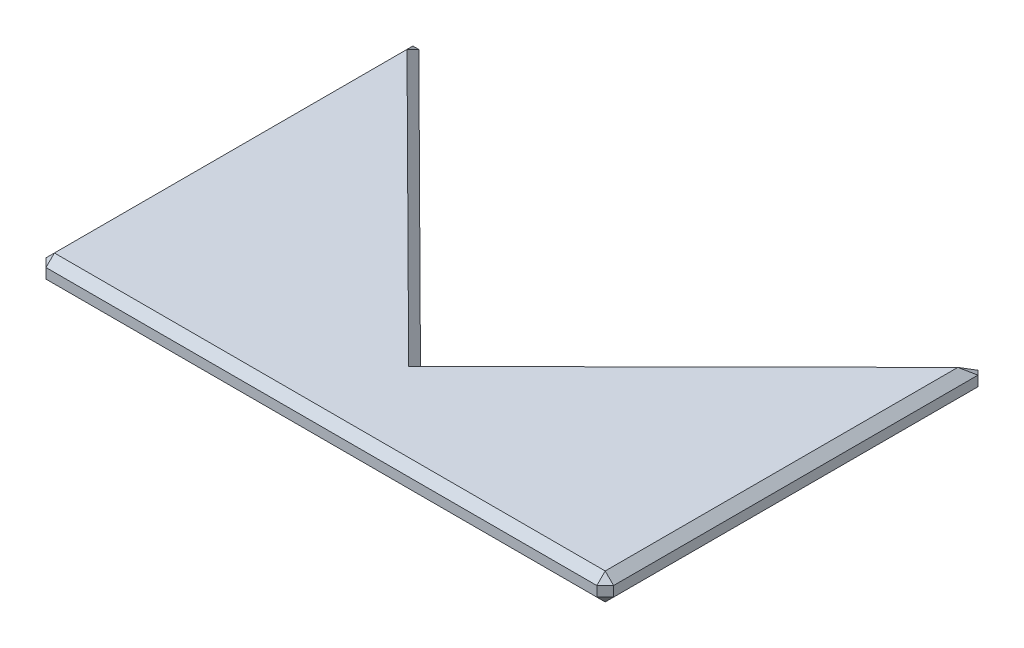
from build123d import *

# Parameters (mm, degrees)
BOSS_EXTRUDE1_DEPTH = 1.6


with BuildPart() as part:
    # Sketch1 → Boss-Extrude1 (new body)
    with BuildSketch(Plane(origin=(0, 0, 0), x_dir=(1, 0, 0), z_dir=(0, 1, 0))):
        Polygon((16.9, 22.7), (16.9, 0), (-16.9, 0), (-16.9, 22.7), (0, 5.9), align=None)
    extrude(amount=BOSS_EXTRUDE1_DEPTH)

    # Chamfer1
    # the kernel refuses this chamfer: 0.5, 0.353554947 mm, written as the material it takes off along each edge
    with BuildSketch(Plane(origin=(-16.566666667, 1.266666667, -0.333333333), x_dir=(-0.7071067811865475, 0, -0.7071067811865475), z_dir=(-0.5773502691896256, 0.5773502691896261, 0.5773502691896256)), Plane(origin=(16.566666667, 1.266666667, -0.333333333), x_dir=(-0.7071067811865475, 0, 0.7071067811865475), z_dir=(0.5773502691896258, 0.5773502691896256, 0.5773502691896258))) as chamfer1_piece_1:
        Polygon((-0.353553391, 0.204124145), (0.353553391, 0.204124145), (0, -0.40824829), align=None)
    extrude(amount=0.635085296, mode=Mode.SUBTRACT)
    with BuildSketch(Plane(origin=(-16.615133017, 1.266666667, -22.06396102), x_dir=(0.9999955974192072, 0, -0.0029673459864134454), z_dir=(-0.0015045248311199464, 0.8619301129134874, -0.507024868086345))) as chamfer1_piece_2:
        Polygon((-0.284027501, 0.328713527), (0.070575009, 0.328713527), (0.213452492, -0.657427055), align=None)
    extrude(amount=0.671248828, mode=Mode.SUBTRACT)
    with BuildSketch(Plane(origin=(16.64975272, 1.266666667, -22.049560855), x_dir=(-0.7071067811865375, 0, -0.7071067811865576), z_dir=(0.35852230087747156, 0.8619301129134861, -0.3585223008774614))) as chamfer1_piece_3:
        Polygon((-0.070575009, -0.328713527), (0.284027501, -0.328713527), (-0.213452492, 0.657427055), align=None)
    extrude(amount=0.671248828, mode=Mode.SUBTRACT)
    with BuildSketch(Plane(origin=(16.64975272, 0.333333333, -22.049560855), x_dir=(-0.7071067811865375, 0, -0.7071067811865576), z_dir=(0.3585223008774716, -0.8619301129134861, -0.3585223008774613))) as chamfer1_piece_4:
        Polygon((-0.070575009, 0.328713527), (0.284027501, 0.328713527), (-0.213452492, -0.657427055), align=None)
    extrude(amount=0.671248828, mode=Mode.SUBTRACT)
    with BuildSketch(Plane(origin=(16.566666667, 0.333333333, -0.333333333), x_dir=(-0.7071067811865475, 0, 0.7071067811865475), z_dir=(0.5773502691896258, -0.5773502691896257, 0.5773502691896258)), Plane(origin=(-16.566666667, 0.333333333, -0.333333333), x_dir=(-0.7071067811865475, 0, -0.7071067811865475), z_dir=(-0.5773502691896256, -0.5773502691896261, 0.5773502691896255))) as chamfer1_piece_5:
        Polygon((-0.353553391, -0.204124145), (0.353553391, -0.204124145), (0, 0.40824829), align=None)
    extrude(amount=0.635085296, mode=Mode.SUBTRACT)
    with BuildSketch(Plane(origin=(-16.615133017, 0.333333333, -22.06396102), x_dir=(0.9999955974192072, 0, -0.0029673459864134454), z_dir=(-0.0015045248311200809, -0.8619301129134874, -0.507024868086345))) as chamfer1_piece_6:
        Polygon((-0.284027501, -0.328713527), (0.070575009, -0.328713527), (0.213452492, 0.657427055), align=None)
    extrude(amount=0.671248828, mode=Mode.SUBTRACT)
    with BuildSketch(Plane(origin=(-16.9, 1.6, 1.285841494), x_dir=(-0.02749587661058907, -0.9996219169112965, 0), z_dir=(0, 0, -1)), Plane(origin=(16.9, 1.6, -23.985841494), x_dir=(0.02749587661058907, -0.9996219169112965, 0), z_dir=(0, 0, 1))) as chamfer1_piece_7:
        with BuildLine():
            Line((0.514336598, 0), (-0.028273577, -0.513558897))
            Line((-0.028273577, -0.513558897), (-0.038269797, -0.513283938))
            ThreePointArc((-0.038269797, -0.513283938), (-0.017064614, -0.256698915), (-0.009996219, 0.000274959))
            Line((-0.009996219, 0.000274959), (0.000274959, 0.009996219))
            ThreePointArc((0.000274959, 0.009996219), (0.257248832, 0.002927825), (0.514611556, 0.009996219))
            Line((0.514611556, 0.009996219), (0.514336598, 0))
        make_face()
    extrude(amount=25.271682988, mode=Mode.SUBTRACT)
    with BuildSketch(Plane(origin=(18.185841494, 1.6, 0), x_dir=(0, -0.9996219169112968, 0.02749587661058636), z_dir=(-1, 0, 0))) as chamfer1_piece_8:
        with BuildLine():
            Line((0.514336598, 0), (-0.028273577, -0.513558897))
            Line((-0.028273577, -0.513558897), (-0.038269797, -0.513283938))
            ThreePointArc((-0.038269797, -0.513283938), (-0.017064614, -0.256698915), (-0.009996219, 0.000274959))
            Line((-0.009996219, 0.000274959), (0.000274959, 0.009996219))
            ThreePointArc((0.000274959, 0.009996219), (0.257248832, 0.002927825), (0.514611556, 0.009996219))
            Line((0.514611556, 0.009996219), (0.514336598, 0))
        make_face()
    extrude(amount=36.371682988, mode=Mode.SUBTRACT)
    with BuildSketch(Plane(origin=(-0.911921229, 1.6, -4.993474755), x_dir=(-0.019384742522666594, -0.9996219169112968, -0.01950012789482532), z_dir=(0.7092018985609293, 0, -0.7050054376226992))) as chamfer1_piece_9_section:
        with BuildLine():
            Line((0.514336598, 0), (-0.028273577, -0.513558897))
            Line((-0.028273577, -0.513558897), (-0.038269797, -0.513283938))
            ThreePointArc((-0.038269797, -0.513283938), (-0.017064614, -0.256698915), (-0.009996219, 0.000274959))
            Line((-0.009996219, 0.000274959), (0.000274959, 0.009996219))
            ThreePointArc((0.000274959, 0.009996219), (0.257248832, 0.002927825), (0.514611556, 0.009996219))
            Line((0.514611556, 0.009996219), (0.514336598, 0))
        make_face()
    chamfer1_piece_9 = extrude(amount=26.401286426, mode=Mode.PRIVATE)
    chamfer1_piece_9 = split(chamfer1_piece_9, bisect_by=Plane(origin=(0.169796373, 1.435101181, -5.731208339), z_dir=(0.705005437622699, 0, -0.7092018985609295)), keep=Keep.TOP, mode=Mode.PRIVATE)
    add(chamfer1_piece_9, mode=Mode.SUBTRACT)
    with BuildSketch(Plane(origin=(16.9, 0, -23.985841494), x_dir=(0.02749587661058908, 0.9996219169112968, 0), z_dir=(0, 0, 1)), Plane(origin=(-16.9, 0, 1.285841494), x_dir=(-0.02749587661058908, 0.9996219169112968, 0), z_dir=(0, 0, -1))) as chamfer1_piece_10:
        with BuildLine():
            Line((0.514336598, 0), (-0.028273577, 0.513558897))
            Line((-0.028273577, 0.513558897), (-0.038269797, 0.513283938))
            ThreePointArc((-0.038269797, 0.513283938), (-0.017064614, 0.256698915), (-0.009996219, -0.000274959))
            Line((-0.009996219, -0.000274959), (0.000274959, -0.009996219))
            ThreePointArc((0.000274959, -0.009996219), (0.257248832, -0.002927825), (0.514611556, -0.009996219))
            Line((0.514611556, -0.009996219), (0.514336598, 0))
        make_face()
    extrude(amount=25.271682988, mode=Mode.SUBTRACT)
    with BuildSketch(Plane(origin=(18.185841494, 0, 0), x_dir=(0, 0.9996219169112968, 0.02749587661058637), z_dir=(-1, 0, 0))) as chamfer1_piece_11:
        with BuildLine():
            Line((0.514336598, 0), (-0.028273577, 0.513558897))
            Line((-0.028273577, 0.513558897), (-0.038269797, 0.513283938))
            ThreePointArc((-0.038269797, 0.513283938), (-0.017064614, 0.256698915), (-0.009996219, -0.000274959))
            Line((-0.009996219, -0.000274959), (0.000274959, -0.009996219))
            ThreePointArc((0.000274959, -0.009996219), (0.257248832, -0.002927825), (0.514611556, -0.009996219))
            Line((0.514611556, -0.009996219), (0.514336598, 0))
        make_face()
    extrude(amount=36.371682988, mode=Mode.SUBTRACT)
    with BuildSketch(Plane(origin=(-17.811921229, 0, -23.606525245), x_dir=(0.019384742522664138, 0.9996219169112968, -0.019500127894822857), z_dir=(0.7092018985609295, 0, 0.705005437622699))) as chamfer1_piece_12_section:
        with BuildLine():
            Line((0.514336598, 0), (-0.028273577, 0.513558897))
            Line((-0.028273577, 0.513558897), (-0.038269797, 0.513283938))
            ThreePointArc((-0.038269797, 0.513283938), (-0.017064614, 0.256698915), (-0.009996219, -0.000274959))
            Line((-0.009996219, -0.000274959), (0.000274959, -0.009996219))
            ThreePointArc((0.000274959, -0.009996219), (0.257248832, -0.002927825), (0.514611556, -0.009996219))
            Line((0.514611556, -0.009996219), (0.514336598, 0))
        make_face()
    chamfer1_piece_12 = extrude(amount=26.401286426, mode=Mode.PRIVATE)
    chamfer1_piece_12 = split(chamfer1_piece_12, bisect_by=Plane(origin=(-0.169796373, 0.164898819, -5.731208339), z_dir=(-0.7050054376226992, 0, -0.7092018985609293)), keep=Keep.TOP, mode=Mode.PRIVATE)
    add(chamfer1_piece_12, mode=Mode.SUBTRACT)
    with BuildSketch(Plane(origin=(-0.911921229, 0, -4.993474755), x_dir=(-0.0193847425226666, 0.9996219169112968, -0.019500127894825324), z_dir=(0.7092018985609293, 0, -0.7050054376226992))) as chamfer1_piece_13_section:
        with BuildLine():
            Line((0.514336598, 0), (-0.028273577, 0.513558897))
            Line((-0.028273577, 0.513558897), (-0.038269797, 0.513283938))
            ThreePointArc((-0.038269797, 0.513283938), (-0.017064614, 0.256698915), (-0.009996219, -0.000274959))
            Line((-0.009996219, -0.000274959), (0.000274959, -0.009996219))
            ThreePointArc((0.000274959, -0.009996219), (0.257248832, -0.002927825), (0.514611556, -0.009996219))
            Line((0.514611556, -0.009996219), (0.514336598, 0))
        make_face()
    chamfer1_piece_13 = extrude(amount=26.401286426, mode=Mode.PRIVATE)
    chamfer1_piece_13 = split(chamfer1_piece_13, bisect_by=Plane(origin=(0.169796373, 0.164898819, -5.731208339), z_dir=(0.705005437622699, 0, -0.7092018985609295)), keep=Keep.TOP, mode=Mode.PRIVATE)
    add(chamfer1_piece_13, mode=Mode.SUBTRACT)
    with BuildSketch(Plane(origin=(-17.811921229, 1.6, -23.606525245), x_dir=(0.019384742522664134, -0.9996219169112968, -0.019500127894822854), z_dir=(0.7092018985609295, 0, 0.705005437622699))) as chamfer1_piece_14_section:
        with BuildLine():
            Line((0.514336598, 0), (-0.028273577, -0.513558897))
            Line((-0.028273577, -0.513558897), (-0.038269797, -0.513283938))
            ThreePointArc((-0.038269797, -0.513283938), (-0.017064614, -0.256698915), (-0.009996219, 0.000274959))
            Line((-0.009996219, 0.000274959), (0.000274959, 0.009996219))
            ThreePointArc((0.000274959, 0.009996219), (0.257248832, 0.002927825), (0.514611556, 0.009996219))
            Line((0.514611556, 0.009996219), (0.514336598, 0))
        make_face()
    chamfer1_piece_14 = extrude(amount=26.401286426, mode=Mode.PRIVATE)
    chamfer1_piece_14 = split(chamfer1_piece_14, bisect_by=Plane(origin=(-0.169796373, 1.435101181, -5.731208339), z_dir=(-0.7050054376226992, 0, -0.7092018985609293)), keep=Keep.TOP, mode=Mode.PRIVATE)
    add(chamfer1_piece_14, mode=Mode.SUBTRACT)
    with BuildSketch(Plane(origin=(16.9, -1.285841494, 0), x_dir=(0.02749587661058908, 0, -0.9996219169112968), z_dir=(0, 1, 0)), Plane(origin=(-16.9, -1.285841494, 0), x_dir=(0.9996219169112968, 0, 0.027495876610586178), z_dir=(0, 1, 0))) as chamfer1_piece_15:
        with BuildLine():
            Line((0.514336598, 0), (-0.028273577, 0.513558897))
            Line((-0.028273577, 0.513558897), (-0.038269797, 0.513283938))
            ThreePointArc((-0.038269797, 0.513283938), (-0.017064614, 0.256698915), (-0.009996219, -0.000274959))
            Line((-0.009996219, -0.000274959), (0.000274959, -0.009996219))
            ThreePointArc((0.000274959, -0.009996219), (0.257248832, -0.002927825), (0.514611556, -0.009996219))
            Line((0.514611556, -0.009996219), (0.514336598, 0))
        make_face()
    extrude(amount=4.171682988, mode=Mode.SUBTRACT)
    with BuildSketch(Plane(origin=(16.9, -1.285841494, -22.7), x_dir=(0.027495876610589005, 0, 0.9996219169112968), z_dir=(0, 1, 0))) as chamfer1_piece_16:
        with BuildLine():
            Line((0.514336598, 0), (0.227743914, -0.271248548))
            Line((0.227743914, -0.271248548), (0.220460729, -0.278100936))
            ThreePointArc((0.220460729, -0.278100936), (0.113871925, -0.135624304), (-0.007283185, -0.006852388))
            Line((-0.007283185, -0.006852388), (0.000274959, 0.009996219))
            ThreePointArc((0.000274959, 0.009996219), (0.257248832, 0.002927825), (0.514611556, 0.009996219))
            Line((0.514611556, 0.009996219), (0.514336598, 0))
        make_face()
    extrude(amount=4.171682988, mode=Mode.SUBTRACT)
    with BuildSketch(Plane(origin=(-16.9, -1.285841494, -22.7), x_dir=(-0.05646830535179678, 0, 0.9984043922633233), z_dir=(0, 1, 0))) as chamfer1_piece_17:
        with BuildLine():
            Line((0.354179425, 0), (0.330727935, 0.393905025))
            Line((0.330727935, 0.393905025), (0.323249127, 0.400543356))
            ThreePointArc((0.323249127, 0.400543356), (0.163173475, 0.198896835), (-0.007478808, 0.006638331))
            Line((-0.007478808, 0.006638331), (0.000564683, -0.009984044))
            ThreePointArc((0.000564683, -0.009984044), (0.177089715, -4.4e-08), (0.354744109, -0.009984044))
            Line((0.354744109, -0.009984044), (0.354179425, 0))
        make_face()
    extrude(amount=4.171682988, mode=Mode.SUBTRACT)
    with BuildSketch(Plane(origin=(-17.811921229, 1.6, -23.606525245), x_dir=(0.019384742522664134, -0.9996219169112968, -0.019500127894822854), z_dir=(0.7092018985609295, 0, 0.705005437622699))) as chamfer1_piece_18a_section:
        with BuildLine():
            Line((0.514336598, 0), (-0.028273577, -0.513558897))
            Line((-0.028273577, -0.513558897), (-0.038269797, -0.513283938))
            ThreePointArc((-0.038269797, -0.513283938), (-0.017064614, -0.256698915), (-0.009996219, 0.000274959))
            Line((-0.009996219, 0.000274959), (0.000274959, 0.009996219))
            ThreePointArc((0.000274959, 0.009996219), (0.257248832, 0.002927825), (0.514611556, 0.009996219))
            Line((0.514611556, 0.009996219), (0.514336598, 0))
        make_face()
    chamfer1_piece_18a = extrude(amount=26.401286426, mode=Mode.PRIVATE)
    chamfer1_piece_18a = split(chamfer1_piece_18a, bisect_by=Plane(origin=(-0.114291086, 1.435142329, -5.786385193), z_dir=(0.7050054376226992, 0, 0.7092018985609293)), keep=Keep.TOP, mode=Mode.PRIVATE)
    with BuildSketch(Plane(origin=(-0.911921229, 1.6, -4.993474755), x_dir=(-0.019384742522666594, -0.9996219169112968, -0.01950012789482532), z_dir=(0.7092018985609293, 0, -0.7050054376226992))) as chamfer1_piece_18b_section:
        with BuildLine():
            Line((0.514336598, 0), (-0.028273577, -0.513558897))
            Line((-0.028273577, -0.513558897), (-0.038269797, -0.513283938))
            ThreePointArc((-0.038269797, -0.513283938), (-0.017064614, -0.256698915), (-0.009996219, 0.000274959))
            Line((-0.009996219, 0.000274959), (0.000274959, 0.009996219))
            ThreePointArc((0.000274959, 0.009996219), (0.257248832, 0.002927825), (0.514611556, 0.009996219))
            Line((0.514611556, 0.009996219), (0.514336598, 0))
        make_face()
    chamfer1_piece_18b = extrude(amount=26.401286426, mode=Mode.PRIVATE)
    chamfer1_piece_18b = split(chamfer1_piece_18b, bisect_by=Plane(origin=(0.114291086, 1.435142329, -5.786385193), z_dir=(-0.705005437622699, 0, 0.7092018985609295)), keep=Keep.TOP, mode=Mode.PRIVATE)
    chamfer1_piece_18 = chamfer1_piece_18a & chamfer1_piece_18b
    add(chamfer1_piece_18, mode=Mode.SUBTRACT)
    with BuildSketch(Plane(origin=(-17.811921229, 0, -23.606525245), x_dir=(0.019384742522664138, 0.9996219169112968, -0.019500127894822857), z_dir=(0.7092018985609295, 0, 0.705005437622699))) as chamfer1_piece_19a_section:
        with BuildLine():
            Line((0.514336598, 0), (-0.028273577, 0.513558897))
            Line((-0.028273577, 0.513558897), (-0.038269797, 0.513283938))
            ThreePointArc((-0.038269797, 0.513283938), (-0.017064614, 0.256698915), (-0.009996219, -0.000274959))
            Line((-0.009996219, -0.000274959), (0.000274959, -0.009996219))
            ThreePointArc((0.000274959, -0.009996219), (0.257248832, -0.002927825), (0.514611556, -0.009996219))
            Line((0.514611556, -0.009996219), (0.514336598, 0))
        make_face()
    chamfer1_piece_19a = extrude(amount=26.401286426, mode=Mode.PRIVATE)
    chamfer1_piece_19a = split(chamfer1_piece_19a, bisect_by=Plane(origin=(-0.114291086, 0.164857671, -5.786385193), z_dir=(0.7050054376226992, 0, 0.7092018985609293)), keep=Keep.TOP, mode=Mode.PRIVATE)
    with BuildSketch(Plane(origin=(-0.911921229, 0, -4.993474755), x_dir=(-0.0193847425226666, 0.9996219169112968, -0.019500127894825324), z_dir=(0.7092018985609293, 0, -0.7050054376226992))) as chamfer1_piece_19b_section:
        with BuildLine():
            Line((0.514336598, 0), (-0.028273577, 0.513558897))
            Line((-0.028273577, 0.513558897), (-0.038269797, 0.513283938))
            ThreePointArc((-0.038269797, 0.513283938), (-0.017064614, 0.256698915), (-0.009996219, -0.000274959))
            Line((-0.009996219, -0.000274959), (0.000274959, -0.009996219))
            ThreePointArc((0.000274959, -0.009996219), (0.257248832, -0.002927825), (0.514611556, -0.009996219))
            Line((0.514611556, -0.009996219), (0.514336598, 0))
        make_face()
    chamfer1_piece_19b = extrude(amount=26.401286426, mode=Mode.PRIVATE)
    chamfer1_piece_19b = split(chamfer1_piece_19b, bisect_by=Plane(origin=(0.114291086, 0.164857671, -5.786385193), z_dir=(-0.705005437622699, 0, 0.7092018985609295)), keep=Keep.TOP, mode=Mode.PRIVATE)
    chamfer1_piece_19 = chamfer1_piece_19a & chamfer1_piece_19b
    add(chamfer1_piece_19, mode=Mode.SUBTRACT)


solid = part.part
